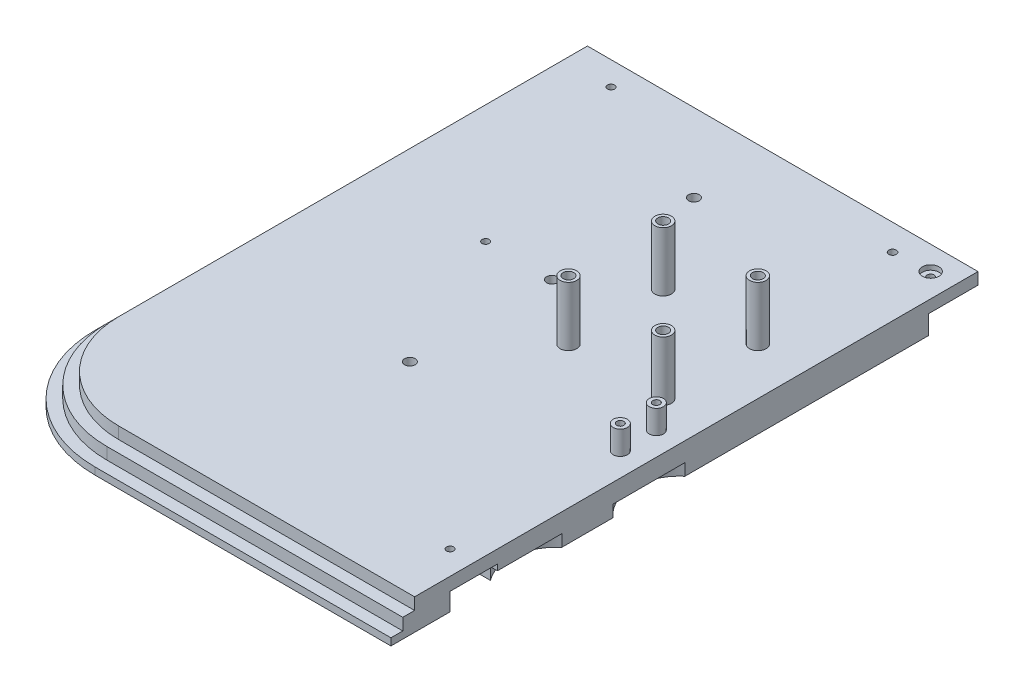
from build123d import *

# Parameters (mm, degrees)
SALIENTE_EXTRUIR1_DEPTH = 3
SALIENTE_EXTRUIR2_DEPTH = 5
SALIENTE_EXTRUIR3_DEPTH = 5
CROQUIS6_R              = 2.25
CORTAR_EXTRUIR3_DEPTH   = 5
CROQUIS7_R              = 1.5
CORTAR_EXTRUIR4_DEPTH   = 286.340147894
CORTAR_EXTRUIR5_DEPTH   = 8
CROQUIS9_R              = 1.5
CORTAR_EXTRUIR6_DEPTH   = 286.340147894
CROQUIS10_W             = 25
CROQUIS10_H             = 50
CORTAR_EXTRUIR7_DEPTH   = 5
CHAFL_N1_SIZE           = 5
CROQUIS13_R             = 3.5
CROQUIS13_R_2           = 2.25
SALIENTE_EXTRUIR4_DEPTH = 25
CROQUIS14_R             = 3
CROQUIS14_R_2           = 1.25
CROQUIS14_R_3           = 1.5
SALIENTE_EXTRUIR5_DEPTH = 10
CROQUIS12_R             = 1.6
CORTAR_EXTRUIR9_DEPTH   = 287.138078556
CROQUIS11_R             = 6
CORTAR_EXTRUIR8_DEPTH   = 5
CROQUIS16_W             = 40
CROQUIS16_H             = 8
CORTAR_EXTRUIR10_DEPTH  = 20
CORTAR_EXTRUIR11_DEPTH  = 20
CROQUIS19_R             = 1.5
CORTAR_EXTRUIR12_DEPTH  = 70
CROQUIS20_W             = 20
CROQUIS20_H             = 7.5
CORTAR_EXTRUIR13_DEPTH  = 20
CROQUIS21_W             = 20
CROQUIS21_H             = 7.5
CORTAR_EXTRUIR14_DEPTH  = 20
CROQUIS23_R             = 3.5
CORTAR_EXTRUIR16_DEPTH  = 2
CROQUIS22_R             = 26
CORTAR_EXTRUIR17_DEPTH  = 6


with BuildPart() as part:
    # Croquis1 → Saliente-Extruir1 (new body)
    with BuildSketch(Plane(origin=(0, 0, 0), x_dir=(1, 0, 0), z_dir=(0, 1, 0))):
        with BuildLine():
            Line((125, 225), (-125, 225))
            ThreePointArc((-125, 225), (-160.355339059, 210.355339059), (-175, 175))
            Line((-175, 175), (-175, -175))
            ThreePointArc((-175, -175), (-160.355339059, -210.355339059), (-125, -225))
            Line((-125, -225), (125, -225))
            ThreePointArc((125, -225), (160.355339059, -210.355339059), (175, -175))
            Line((175, -175), (175, 175))
            ThreePointArc((175, 175), (160.355339059, 210.355339059), (125, 225))
        make_face()
    extrude(amount=SALIENTE_EXTRUIR1_DEPTH)

    # Croquis2 → Saliente-Extruir2 (add)
    with BuildSketch(Plane(origin=(0, 3, 0), x_dir=(1, 0, 0), z_dir=(0, 1, 0))):
        with BuildLine():
            Line((-125, -220), (125, -220))
            ThreePointArc((125, -220), (156.819805153, -206.819805153), (170, -175))
            Line((170, -175), (170, 175))
            ThreePointArc((170, 175), (156.819805153, 206.819805153), (125, 220))
            Line((125, 220), (-125, 220))
            ThreePointArc((-125, 220), (-156.819805153, 206.819805153), (-170, 175))
            Line((-170, 175), (-170, -175))
            ThreePointArc((-170, -175), (-156.819805153, -206.819805153), (-125, -220))
        make_face()
    extrude(amount=SALIENTE_EXTRUIR2_DEPTH)

    # Croquis3 → Saliente-Extruir3 (add)
    with BuildSketch(Plane(origin=(0, 8, 0), x_dir=(1, 0, 0), z_dir=(0, 1, 0))):
        with BuildLine():
            Line((-125, -215), (125, -215))
            ThreePointArc((125, -215), (153.284271247, -203.284271247), (165, -175))
            Line((165, -175), (165, 175))
            ThreePointArc((165, 175), (153.284271247, 203.284271247), (125, 215))
            Line((125, 215), (-125, 215))
            ThreePointArc((-125, 215), (-153.284271247, 203.284271247), (-165, 175))
            Line((-165, 175), (-165, -175))
            ThreePointArc((-165, -175), (-153.284271247, -203.284271247), (-125, -215))
        make_face()
    extrude(amount=SALIENTE_EXTRUIR3_DEPTH)

    # Croquis6 → Cortar-Extruir3 (cut)
    with BuildSketch(Plane(origin=(0, 13, 0), x_dir=(1, 0, 0), z_dir=(0, 1, 0))):
        with Locations(Location((-87, -130, 0), (0, 0, 270))):
            Circle(CROQUIS6_R)
        with Locations(Location((-87, -70, 0), (0, 0, 270))):
            Circle(CROQUIS6_R)
        with Locations(Location((-87, -10, 0), (0, 0, 270))):
            Circle(CROQUIS6_R)
        with Locations(Location((87, -130, 0), (0, 0, 90))):
            Circle(CROQUIS6_R)
        with Locations(Location((87, -70, 0), (0, 0, 90))):
            Circle(CROQUIS6_R)
        with Locations(Location((87, -10, 0), (0, 0, 90))):
            Circle(CROQUIS6_R)
    extrude(amount=-CORTAR_EXTRUIR3_DEPTH, mode=Mode.SUBTRACT)

    # Croquis7 → Cortar-Extruir4 (cut, through all)
    with BuildSketch(Plane(origin=(0, 13, 0), x_dir=(1, 0, 0), z_dir=(0, 1, 0))):
        with Locations(Location((-115, -70, 0), (0, 0, 270))):
            Circle(CROQUIS7_R)
        with Locations(Location((-115, 130, 0), (0, 0, 270))):
            Circle(CROQUIS7_R)
        with Locations(Location((115, -70, 0), (0, 0, 90))):
            Circle(CROQUIS7_R)
        with Locations(Location((115, 130, 0), (0, 0, 90))):
            Circle(CROQUIS7_R)
    extrude(amount=-CORTAR_EXTRUIR4_DEPTH, mode=Mode.SUBTRACT)

    # Croquis8 → Cortar-Extruir5 (cut)
    with BuildSketch(Plane(origin=(0, 13, 0), x_dir=(1, 0, 0), z_dir=(0, 1, 0))):
        with BuildLine():
            Line((16.014653583, -158), (16.014653583, -178))
            ThreePointArc((16.014653583, -178), (13.014653583, -181), (10.014653583, -178))
            Line((10.014653583, -178), (10.014653583, -158))
            ThreePointArc((10.014653583, -158), (13.014653583, -155), (16.014653583, -158))
        make_face()
        with BuildLine():
            Line((28.014653583, -158), (28.014653583, -178))
            ThreePointArc((28.014653583, -178), (25.014653583, -181), (22.014653583, -178))
            Line((22.014653583, -178), (22.014653583, -158))
            ThreePointArc((22.014653583, -158), (25.014653583, -155), (28.014653583, -158))
        make_face()
        with BuildLine():
            Line((28.014653583, -106), (28.014653583, -126))
            ThreePointArc((28.014653583, -126), (25.014653583, -129), (22.014653583, -126))
            Line((22.014653583, -126), (22.014653583, -106))
            ThreePointArc((22.014653583, -106), (25.014653583, -103), (28.014653583, -106))
        make_face()
        with BuildLine():
            Line((16.014653583, -106), (16.014653583, -126))
            ThreePointArc((16.014653583, -126), (13.014653583, -129), (10.014653583, -126))
            Line((10.014653583, -126), (10.014653583, -106))
            ThreePointArc((10.014653583, -106), (13.014653583, -103), (16.014653583, -106))
        make_face()
    extrude(amount=-CORTAR_EXTRUIR5_DEPTH, mode=Mode.SUBTRACT)

    # Croquis9 → Cortar-Extruir6 (cut, through all)
    with BuildSketch(Plane(origin=(0, 13, 0), x_dir=(1, 0, 0), z_dir=(0, 1, 0))):
        with Locations(Location((13.014653583, -168, 0), (0, 0, 270))):
            Circle(CROQUIS9_R)
        with Locations(Location((25.014653583, -168, 0), (0, 0, 270))):
            Circle(CROQUIS9_R)
        with Locations(Location((13.014653583, -116, 0), (0, 0, 270))):
            Circle(CROQUIS9_R)
        with Locations(Location((25.014653583, -116, 0), (0, 0, 270))):
            Circle(CROQUIS9_R)
        with Locations(Location((-87, -130, 0), (0, 0, 270))):
            Circle(CROQUIS9_R)
        with Locations(Location((-87, -70, 0), (0, 0, 270))):
            Circle(CROQUIS9_R)
        with Locations(Location((-87, -10, 0), (0, 0, 270))):
            Circle(CROQUIS9_R)
        with Locations(Location((87, -10, 0), (0, 0, 270))):
            Circle(CROQUIS9_R)
        with Locations(Location((87, -70, 0), (0, 0, 270))):
            Circle(CROQUIS9_R)
        with Locations(Location((87, -130, 0), (0, 0, 270))):
            Circle(CROQUIS9_R)
    extrude(amount=-CORTAR_EXTRUIR6_DEPTH, mode=Mode.SUBTRACT)

    # Croquis10 → Cortar-Extruir7 (cut)
    with BuildSketch(Plane(origin=(0, 13, 0), x_dir=(1, 0, 0), z_dir=(0, 1, 0))):
        with Locations((62.5, -145)):
            Rectangle(CROQUIS10_W, CROQUIS10_H)
    extrude(amount=-CORTAR_EXTRUIR7_DEPTH, mode=Mode.SUBTRACT)

    # Chaflán1
    chafl_n1_edges = [part.edges().sort_by_distance(p)[0] for p in [
        (62.5, 13, 120),
        (50, 13, 145),
        (62.5, 13, 170),
        (75, 13, 145),
    ]]
    chamfer(chafl_n1_edges, length=CHAFL_N1_SIZE - 0.0001)  # a hair under: the kernel refuses the full size

    # Croquis13 → Saliente-Extruir4 (add)
    # profile 1 of 4: a face of its own
    with BuildSketch(Plane(origin=(0, 13, 0), x_dir=(1, 0, 0), z_dir=(0, 1, 0))):
        with Locations(Location((-20, -50, 0), (0, 0, 270))):
            Circle(CROQUIS13_R)
        with Locations(Location((-20, -50, 0), (0, 0, 270))):
            Circle(CROQUIS13_R_2, mode=Mode.SUBTRACT)
    # profile 2 of 4: a face of its own
    with BuildSketch(Plane(origin=(0, 13, 0), x_dir=(1, 0, 0), z_dir=(0, 1, 0))):
        with Locations(Location((-60, -50, 0), (0, 0, 270))):
            Circle(CROQUIS13_R)
        with Locations(Location((-60, -50, 0), (0, 0, 270))):
            Circle(CROQUIS13_R_2, mode=Mode.SUBTRACT)
    # profile 3 of 4: a face of its own
    with BuildSketch(Plane(origin=(0, 13, 0), x_dir=(1, 0, 0), z_dir=(0, 1, 0))):
        with Locations(Location((-60, -90, 0), (0, 0, 270))):
            Circle(CROQUIS13_R)
        with Locations(Location((-60, -90, 0), (0, 0, 270))):
            Circle(CROQUIS13_R_2, mode=Mode.SUBTRACT)
    # profile 4 of 4: a face of its own
    with BuildSketch(Plane(origin=(0, 13, 0), x_dir=(1, 0, 0), z_dir=(0, 1, 0))):
        with Locations(Location((-20, -90, 0), (0, 0, 270))):
            Circle(CROQUIS13_R)
        with Locations(Location((-20, -90, 0), (0, 0, 270))):
            Circle(CROQUIS13_R_2, mode=Mode.SUBTRACT)
    extrude(amount=SALIENTE_EXTRUIR4_DEPTH)

    # Croquis14 → Saliente-Extruir5 (add)
    # profile 1 of 6: a face of its own
    with BuildSketch(Plane(origin=(0, 13, 0), x_dir=(1, 0, 0), z_dir=(0, 1, 0))):
        with Locations(Location((67.55, -40, 0), (0, 0, 270))):
            Circle(CROQUIS14_R)
        with Locations(Location((67.55, -40, 0), (0, 0, 270))):
            Circle(CROQUIS14_R_2, mode=Mode.SUBTRACT)
    # profile 2 of 6: a face of its own
    with BuildSketch(Plane(origin=(0, 13, 0), x_dir=(1, 0, 0), z_dir=(0, 1, 0))):
        with Locations(Location((3.15, -40, 0), (0, 0, 270))):
            Circle(CROQUIS14_R)
        with Locations(Location((3.15, -40, 0), (0, 0, 270))):
            Circle(CROQUIS14_R_2, mode=Mode.SUBTRACT)
    # profile 3 of 6: a face of its own
    with BuildSketch(Plane(origin=(0, 13, 0), x_dir=(1, 0, 0), z_dir=(0, 1, 0))):
        with Locations(Location((3, -91.9, 0), (0, 0, 270))):
            Circle(CROQUIS14_R)
        with Locations(Location((3, -91.9, 0), (0, 0, 270))):
            Circle(CROQUIS14_R_2, mode=Mode.SUBTRACT)
    # profile 4 of 6: a face of its own
    with BuildSketch(Plane(origin=(0, 13, 0), x_dir=(1, 0, 0), z_dir=(0, 1, 0))):
        with Locations(Location((67.4, -91.9, 0), (0, 0, 270))):
            Circle(CROQUIS14_R)
        with Locations(Location((67.4, -91.9, 0), (0, 0, 270))):
            Circle(CROQUIS14_R_2, mode=Mode.SUBTRACT)
    # profile 5 of 6: a face of its own
    with BuildSketch(Plane(origin=(0, 13, 0), x_dir=(1, 0, 0), z_dir=(0, 1, 0))):
        with Locations(Location((-10, -102.9, 0), (0, 0, 270))):
            Circle(CROQUIS14_R)
        with Locations(Location((-10, -102.9, 0), (0, 0, 270))):
            Circle(CROQUIS14_R_3, mode=Mode.SUBTRACT)
    # profile 6 of 6: a face of its own
    with BuildSketch(Plane(origin=(0, 13, 0), x_dir=(1, 0, 0), z_dir=(0, 1, 0))):
        with Locations(Location((-10, -118.108484849, 0), (0, 0, 270))):
            Circle(CROQUIS14_R)
        with Locations(Location((-10, -118.108484849, 0), (0, 0, 270))):
            Circle(CROQUIS14_R_3, mode=Mode.SUBTRACT)
    extrude(amount=SALIENTE_EXTRUIR5_DEPTH)

    # Croquis12 → Cortar-Extruir9 (cut, through all)
    with BuildSketch(Plane(origin=(0, 13, 0), x_dir=(1, 0, 0), z_dir=(0, 1, 0))):
        with Locations(Location((-25.1, 162.2, 0), (0, 0, 270))):
            Circle(CROQUIS12_R)
        with Locations(Location((25.1, 162.2, 0), (0, 0, 270))):
            Circle(CROQUIS12_R)
        with Locations(Location((-25.1, 12, 0), (0, 0, 270))):
            Circle(CROQUIS12_R)
        with Locations(Location((25.1, 12, 0), (0, 0, 270))):
            Circle(CROQUIS12_R)
    extrude(amount=-CORTAR_EXTRUIR9_DEPTH, mode=Mode.SUBTRACT)

    # Croquis11 → Cortar-Extruir8 (cut)
    with BuildSketch(Plane.XZ):
        with Locations(Location((87, 130, 0), (0, 0, 270))):
            Circle(CROQUIS11_R)
        with Locations(Location((87, 70, 0), (0, 0, 270))):
            Circle(CROQUIS11_R)
        with Locations(Location((87, 10, 0), (0, 0, 270))):
            Circle(CROQUIS11_R)
        with Locations(Location((-87, 10, 0), (0, 0, 270))):
            Circle(CROQUIS11_R)
        with Locations(Location((-87, 70, 0), (0, 0, 270))):
            Circle(CROQUIS11_R)
        with Locations(Location((-87, 130, 0), (0, 0, 270))):
            Circle(CROQUIS11_R)
        with Locations(Location((-115, 70, 0), (0, 0, 270))):
            Circle(CROQUIS11_R)
        with Locations(Location((115, 70, 0), (0, 0, 270))):
            Circle(CROQUIS11_R)
        with Locations(Location((115, -130, 0), (0, 0, 270))):
            Circle(CROQUIS11_R)
        with Locations(Location((-115, -130, 0), (0, 0, 270))):
            Circle(CROQUIS11_R)
        with Locations(Location((-25.1, -162.2, 0), (0, 0, 270))):
            Circle(CROQUIS11_R)
        with Locations(Location((25.1, -162.2, 0), (0, 0, 270))):
            Circle(CROQUIS11_R)
        with Locations(Location((-25.1, -12, 0), (0, 0, 270))):
            Circle(CROQUIS11_R)
        with Locations(Location((25.1, -12, 0), (0, 0, 270))):
            Circle(CROQUIS11_R)
        with BuildLine():
            Line((13.014653583, 188), (25.014653583, 188))
            ThreePointArc((25.014653583, 188), (45.014653583, 168), (25.014653583, 148))
            Line((25.014653583, 148), (13.014653583, 148))
            ThreePointArc((13.014653583, 148), (-6.985346417, 168), (13.014653583, 188))
        make_face()
        with BuildLine():
            Line((13.014653583, 136), (25.014653583, 136))
            ThreePointArc((25.014653583, 136), (45.014653583, 116), (25.014653583, 96))
            Line((25.014653583, 96), (13.014653583, 96))
            ThreePointArc((13.014653583, 96), (-6.985346417, 116), (13.014653583, 136))
        make_face()
    extrude(amount=-CORTAR_EXTRUIR8_DEPTH, mode=Mode.SUBTRACT)

    # Croquis16 → Cortar-Extruir10 (cut, symmetric)
    with BuildSketch(Plane(origin=(0, 0, 0), x_dir=(0, 0, -1), z_dir=(1, 0, 0))):
        with Locations((22, 4)):
            Rectangle(CROQUIS16_W, CROQUIS16_H)
    extrude(amount=CORTAR_EXTRUIR10_DEPTH, both=True, mode=Mode.SUBTRACT)

    # Croquis17 → Cortar-Extruir11 (cut, symmetric)
    with BuildSketch(Plane(origin=(0, 13, 0), x_dir=(1, 0, 0), z_dir=(0, 1, 0))):
        Polygon((-175, 23), (0, 23), (0, -225), (175, -225), (175, 225), (-175, 225), align=None)
    extrude(amount=CORTAR_EXTRUIR11_DEPTH, both=True, mode=Mode.SUBTRACT)

    # Croquis19 → Cortar-Extruir12 (cut)
    with BuildSketch(Plane(origin=(0, 13, 0), x_dir=(1, 0, 0), z_dir=(0, 1, 0))):
        with Locations(Location((-145, 13, 0), (0, 0, 270))):
            Circle(CROQUIS19_R)
        with Locations(Location((-10, -190, 0), (0, 0, 270))):
            Circle(CROQUIS19_R)
        with Locations(Location((-10, 13, 0), (0, 0, 270))):
            Circle(CROQUIS19_R)
    extrude(amount=-CORTAR_EXTRUIR12_DEPTH, mode=Mode.SUBTRACT)

    # Croquis20 → Cortar-Extruir13 (cut)
    with BuildSketch(Plane(origin=(0, 0, 0), x_dir=(0, 0, -1), z_dir=(1, 0, 0))):
        with Locations((-190, 3.75)):
            Rectangle(CROQUIS20_W, CROQUIS20_H)
    extrude(amount=-CORTAR_EXTRUIR13_DEPTH, mode=Mode.SUBTRACT)

    # Croquis21 → Cortar-Extruir14 (cut)
    with BuildSketch(Plane(origin=(0, 0, -23), x_dir=(-1, 0, 0), z_dir=(0, 0, -1))):
        with Locations((145, 3.75)):
            Rectangle(CROQUIS21_W, CROQUIS21_H)
    extrude(amount=-CORTAR_EXTRUIR14_DEPTH, mode=Mode.SUBTRACT)

    # Croquis23 → Cortar-Extruir16 (cut)
    with BuildSketch(Plane(origin=(0, 13, 0), x_dir=(1, 0, 0), z_dir=(0, 1, 0))):
        with Locations(Location((-10, 13, 0), (0, 0, 270))):
            Circle(CROQUIS23_R)
    extrude(amount=-CORTAR_EXTRUIR16_DEPTH, mode=Mode.SUBTRACT)

    # Croquis22 → Cortar-Extruir17 (cut)
    with BuildSketch(Plane.XZ):
        with BuildLine():
            Line((-27, 3.886786963), (-27, 5))
            Line((-27, 5), (-7, 5))
            Line((-7, 5), (-7, 97.877813544))
            ThreePointArc((-7, 97.877813544), (-13.985346417, 116), (-7, 134.122186456))
            Line((-7, 134.122186456), (-7, 149.877813544))
            ThreePointArc((-7, 149.877813544), (-12.972455743, 160.674008676), (-13.51834474, 173))
            Line((-13.51834474, 173), (-27, 173))
            Line((-27, 173), (-27, 207))
            Line((-27, 207), (-7, 207))
            Line((-7, 207), (-7, 218))
            Line((-7, 218), (-125, 218))
            ThreePointArc((-125, 218), (-155.405591591, 205.405591591), (-168, 175))
            Line((-168, 175), (-168, -16))
            Line((-168, -16), (-162, -16))
            Line((-162, -16), (-162, 4))
            Line((-162, 4), (-128, 4))
            Line((-128, 4), (-128, -16))
            Line((-128, -16), (-94.280109889, -16))
            ThreePointArc((-94.280109889, -16), (-87, 37), (-79.719890111, -16))
            Line((-79.719890111, -16), (-40.591933385, -16))
            ThreePointArc((-40.591933385, -16), (-38.309500772, -2.971761558), (-27, 3.886786963))
        make_face()
        with Locations(Location((-87, 130, 0), (0, 0, 270))):
            Circle(CROQUIS22_R, mode=Mode.SUBTRACT)
        with BuildLine():
            ThreePointArc((-108.5, 84.620191517), (-131, 70), (-108.5, 55.379808483))
            ThreePointArc((-108.5, 55.379808483), (-61, 70), (-108.5, 84.620191517))
        make_face(mode=Mode.SUBTRACT)
    extrude(amount=-CORTAR_EXTRUIR17_DEPTH, mode=Mode.SUBTRACT)


solid = part.part
